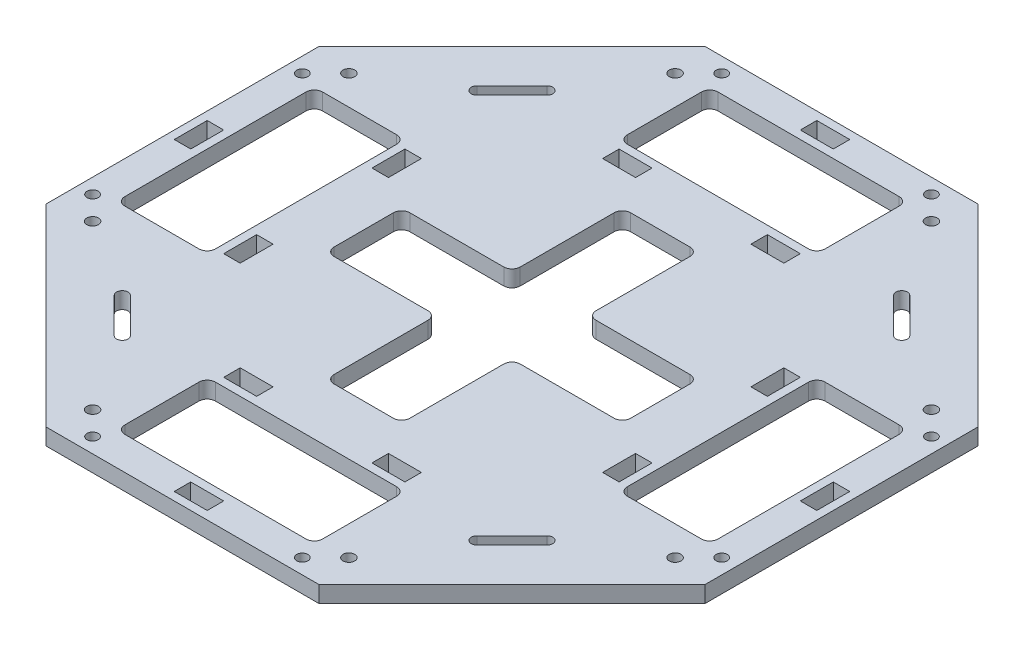
from build123d import *

# Parameters (mm, degrees)
BASE_DEPTH                                 = 6.35
WHEEL_CUTOUT_REACH                         = 181.717
SKETCH3_W                                  = 76.2
SKETCH3_H                                  = 34.925
WHEEL_CUTOUT_FILLETS_R                     = 3.175
WHEEL_CUTOUT_PATTERN_COUNT                 = 4
WHEEL_CUTOUT_FILLETS_OF_WHEEL_CUTOUT_PAT_R = 3.175
SUPPORT_CUTOUTS_REACH                      = 181.717
SKETCH4_W                                  = 12.7
SKETCH4_H                                  = 6.35
SUPPORT_CUTOUT_PATTERN_COUNT               = 4
MOTOR_CLEARANCE_DEPTH                      = 180.717340566
CIRPATTERN1_COUNT                          = 4
FILLET1_R                                  = 3.175
ALIGNER_HOLE_SKETCH_R                      = 2.2479
ALIGNER_HOLES_DEPTH                        = 180.717340566
ALIGNER_HOLE_PATTERN_COUNT                 = 4
SKETCH7_R                                  = 2.15265
CUT_EXTRUDE2_DEPTH                         = 180.717340566
SKETCH9_OUTSIDE_W                          = 327.854
SKETCH9_OUTSIDE_H                          = 327.854
LIMIT_SWITCH_MOUNT_HOLE_DEPTH              = 180.717340566
LIMIT_SWITCH_MOUNT_HOLE_PATTERN_COUNT      = 4


with BuildPart() as part:
    # Base sketch → Base (new body)
    with BuildSketch(Plane(origin=(0, 0, 0), x_dir=(1, 0, 0), z_dir=(0, 1, 0))):
        Polygon((-127, 52.605122421), (-127, -52.605122421), (-52.605122421, -127), (52.605122421, -127), (127, -52.605122421), (127, 52.605122421), (52.605122421, 127), (-52.605122421, 127), align=None)
    extrude(amount=BASE_DEPTH)

    # Sketch3 → Wheel cutout (cut, up to next)
    with BuildSketch(Plane(origin=(0, 6.35, 0), x_dir=(1, 0, 0), z_dir=(0, 1, 0)), mode=Mode.PRIVATE) as wheel_cutout_sk1:
        with Locations((0, 96.8375)):
            Rectangle(SKETCH3_W, SKETCH3_H)
    wheel_cutout_tool1 = extrude(wheel_cutout_sk1.sketch, amount=-WHEEL_CUTOUT_REACH, mode=Mode.PRIVATE) & part.part
    wheel_cutout = wheel_cutout_tool1.solids().sort_by_distance((0, 6.35, -96.8375))[0]
    add(wheel_cutout, mode=Mode.SUBTRACT)

    # Wheel cutout fillets
    wheel_cutout_fillets_edges = [part.edges().sort_by_distance(p)[0] for p in [
        (38.1, 3.175, -114.3),
        (38.1, 3.175, -79.375),
        (-38.1, 3.175, -79.375),
        (-38.1, 3.175, -114.3),
    ]]
    fillet(wheel_cutout_fillets_edges, radius=WHEEL_CUTOUT_FILLETS_R)

    # Wheel cutout pattern: Wheel cutout ×4 about axis
    wheel_cutout_pattern_axis = Axis((0, -0.29972, 0), (0, 1, 0))
    for i in range(1, WHEEL_CUTOUT_PATTERN_COUNT):
        add(wheel_cutout.rotate(wheel_cutout_pattern_axis, i * 360 / WHEEL_CUTOUT_PATTERN_COUNT), mode=Mode.SUBTRACT)

    # Wheel cutout fillets of Wheel cutout pat
    wheel_cutout_fillets_of_wheel_cutout_pat_edges = [part.edges().sort_by_distance(p)[0] for p in [
        (-114.3, 3.175, -38.1),
        (-79.375, 3.175, -38.1),
        (-79.375, 3.175, 38.1),
        (-114.3, 3.175, 38.1),
        (-38.1, 3.175, 114.3),
        (-38.1, 3.175, 79.375),
        (38.1, 3.175, 79.375),
        (38.1, 3.175, 114.3),
        (114.3, 3.175, 38.1),
        (79.375, 3.175, 38.1),
        (79.375, 3.175, -38.1),
        (114.3, 3.175, -38.1),
    ]]
    fillet(wheel_cutout_fillets_of_wheel_cutout_pat_edges, radius=WHEEL_CUTOUT_FILLETS_OF_WHEEL_CUTOUT_PAT_R)

    # Sketch4 → Support cutouts (cut, up to next)
    with BuildSketch(Plane(origin=(0, 6.35, 0), x_dir=(1, 0, 0), z_dir=(0, 1, 0)), mode=Mode.PRIVATE) as support_cutouts_sk1:
        with Locations((28.575, 73.025)):
            Rectangle(SKETCH4_W, SKETCH4_H)
    support_cutouts_tool1 = extrude(support_cutouts_sk1.sketch, amount=-SUPPORT_CUTOUTS_REACH, mode=Mode.PRIVATE) & part.part
    # Sketch4 → Support cutouts (cut, up to next)
    with BuildSketch(Plane(origin=(0, 6.35, 0), x_dir=(1, 0, 0), z_dir=(0, 1, 0)), mode=Mode.PRIVATE) as support_cutouts_sk2:
        with Locations((-28.575, 73.025)):
            Rectangle(SKETCH4_W, SKETCH4_H)
    support_cutouts_tool2 = extrude(support_cutouts_sk2.sketch, amount=-SUPPORT_CUTOUTS_REACH, mode=Mode.PRIVATE) & part.part
    # Sketch4 → Support cutouts (cut, up to next)
    with BuildSketch(Plane(origin=(0, 6.35, 0), x_dir=(1, 0, 0), z_dir=(0, 1, 0)), mode=Mode.PRIVATE) as support_cutouts_sk3:
        with Locations((0, 120.65)):
            Rectangle(SKETCH4_W, SKETCH4_H)
    support_cutouts_tool3 = extrude(support_cutouts_sk3.sketch, amount=-SUPPORT_CUTOUTS_REACH, mode=Mode.PRIVATE) & part.part
    support_cutouts_1 = support_cutouts_tool1.solids().sort_by_distance((28.575, 6.35, -73.025))[0]
    add(support_cutouts_1, mode=Mode.SUBTRACT)
    support_cutouts_2 = support_cutouts_tool2.solids().sort_by_distance((-28.575, 6.35, -73.025))[0]
    add(support_cutouts_2, mode=Mode.SUBTRACT)
    support_cutouts_3 = support_cutouts_tool3.solids().sort_by_distance((0, 6.35, -120.65))[0]
    add(support_cutouts_3, mode=Mode.SUBTRACT)
    support_cutouts = support_cutouts_1 + support_cutouts_2 + support_cutouts_3  # Support cutouts as one shape, for the pattern or mirror that repeats it

    # Support cutout pattern: Support cutouts ×4 about axis
    support_cutout_pattern_axis = Axis((0, -0.29972, 0), (0, 1, 0))
    for i in range(1, SUPPORT_CUTOUT_PATTERN_COUNT):
        add(support_cutouts.rotate(support_cutout_pattern_axis, i * 360 / SUPPORT_CUTOUT_PATTERN_COUNT), mode=Mode.SUBTRACT)

    # Sketch5 → Motor Clearance (cut, through all)
    with BuildSketch(Plane(origin=(0, 6.35, 0), x_dir=(1, 0, 0), z_dir=(0, 1, 0))):
        Polygon((14.605, 57.15), (-14.605, 57.15), (-14.605, 14.605), (0, 0), (14.605, 14.605), align=None)
    motor_clearance = extrude(amount=-MOTOR_CLEARANCE_DEPTH, mode=Mode.SUBTRACT)

    # CirPattern1: Motor Clearance ×4 about axis
    cirpattern1_axis = Axis((0, -0.29972, 0), (0, 1, 0))
    for i in range(1, CIRPATTERN1_COUNT):
        add(motor_clearance.rotate(cirpattern1_axis, i * 360 / CIRPATTERN1_COUNT), mode=Mode.SUBTRACT)

    # Fillet1
    fillet1_edges = [part.edges().sort_by_distance(p)[0] for p in [
        (-14.605, 3.175, 57.15),
        (-57.15, 3.175, 14.605),
        (14.605, 3.175, 57.15),
        (-14.605, 3.175, 14.605),
        (14.605, 3.175, 14.605),
        (14.605, 3.175, -14.605),
        (57.15, 3.175, 14.605),
        (57.15, 3.175, -14.605),
        (14.605, 3.175, -57.15),
        (-14.605, 3.175, -14.605),
        (-14.605, 3.175, -57.15),
        (-57.15, 3.175, -14.605),
    ]]
    fillet(fillet1_edges, radius=FILLET1_R)

    # Aligner hole sketch → Aligner holes (cut, through all)
    with BuildSketch(Plane(origin=(0, 6.35, 0), x_dir=(1, 0, 0), z_dir=(0, 1, 0))):
        with Locations((-49.391408666, 112.253201513)):
            Circle(ALIGNER_HOLE_SKETCH_R)
        with Locations((-112.253201513, 49.391408666)):
            Circle(ALIGNER_HOLE_SKETCH_R)
    aligner_holes = extrude(amount=-ALIGNER_HOLES_DEPTH, mode=Mode.SUBTRACT)

    # Aligner hole pattern: Aligner holes ×4 about axis
    aligner_hole_pattern_axis = Axis((0, -0.29972, 0), (0, 1, 0))
    for i in range(1, ALIGNER_HOLE_PATTERN_COUNT):
        add(aligner_holes.rotate(aligner_hole_pattern_axis, i * 360 / ALIGNER_HOLE_PATTERN_COUNT), mode=Mode.SUBTRACT)

    # Sketch7 → Cut-Extrude2 (cut, through all)
    with BuildSketch(Plane(origin=(0, 6.35, 0), x_dir=(1, 0, 0), z_dir=(0, 1, 0))):
        with Locations((121.233457634, 40.411152545)):
            Circle(SKETCH7_R)
        with Locations((121.233457634, -40.411152545)):
            Circle(SKETCH7_R)
        with Locations((40.411152545, -121.233457634)):
            Circle(SKETCH7_R)
        with Locations((-40.411152545, -121.233457634)):
            Circle(SKETCH7_R)
        with Locations((-121.233457634, -40.411152545)):
            Circle(SKETCH7_R)
        with Locations((-121.233457634, 40.411152545)):
            Circle(SKETCH7_R)
        with Locations((-40.411152545, 121.233457634)):
            Circle(SKETCH7_R)
        with Locations((40.411152545, 121.233457634)):
            Circle(SKETCH7_R)
    extrude(amount=-CUT_EXTRUDE2_DEPTH, mode=Mode.SUBTRACT)

    # Sketch9 outside → limit switch mount hole (cut, through all)
    # profile 1 of 2: a face of its own
    with BuildSketch(Plane(origin=(0, 6.35, 0), x_dir=(1, 0, 0), z_dir=(0, 1, 0))):
        Rectangle(SKETCH9_OUTSIDE_W, SKETCH9_OUTSIDE_H)
        Polygon((-52.605122421, 127), (-127, 52.605122421), (-127, -52.605122421), (-52.605122421, -127), (52.605122421, -127), (127, -52.605122421), (127, 52.605122421), (52.605122421, 127), align=None, mode=Mode.SUBTRACT)
    # profile 2 of 2: a face of its own
    with BuildSketch(Plane(origin=(0, 6.35, 0), x_dir=(1, 0, 0), z_dir=(0, 1, 0))):
        with BuildLine():
            Line((-80.267065716, 66.796681535), (-66.796681535, 80.267065716))
            ThreePointArc((-66.796681535, 80.267065716), (-66.796681535, 83.392350594), (-69.921966412, 83.392350594))
            Line((-69.921966412, 83.392350594), (-83.392350594, 69.921966412))
            ThreePointArc((-83.392350594, 69.921966412), (-83.392350594, 66.796681535), (-80.267065716, 66.796681535))
        make_face()
    limit_switch_mount_hole = extrude(amount=-LIMIT_SWITCH_MOUNT_HOLE_DEPTH, mode=Mode.SUBTRACT)

    # limit switch mount hole pattern: limit switch mount hole ×4 about axis
    limit_switch_mount_hole_pattern_axis = Axis((0, -0.29972, 0), (0, 1, 0))
    for i in range(1, LIMIT_SWITCH_MOUNT_HOLE_PATTERN_COUNT):
        add(limit_switch_mount_hole.rotate(limit_switch_mount_hole_pattern_axis, i * 360 / LIMIT_SWITCH_MOUNT_HOLE_PATTERN_COUNT), mode=Mode.SUBTRACT)


solid = part.part
